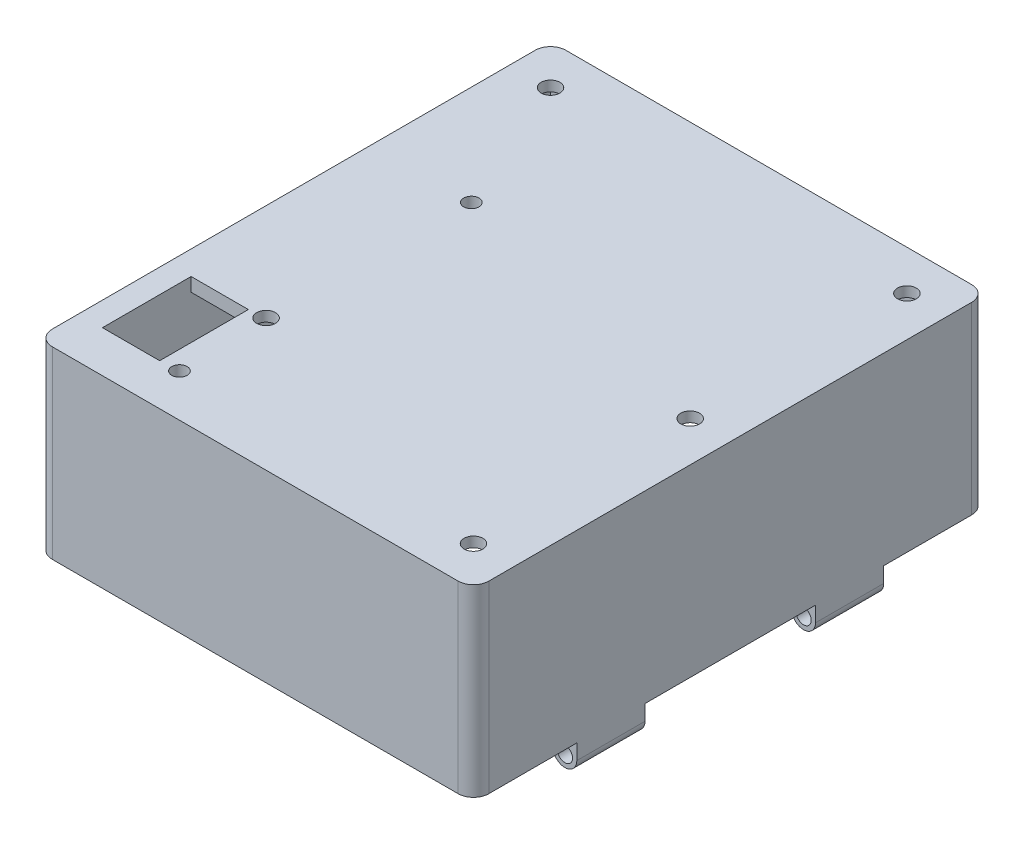
from build123d import *

# Parameters (mm, degrees)
EXTRUDE_BASE_DEPTH              = 2
SKETCH2_W                       = 57
SKETCH2_H                       = 68.2942
EXTRUDE_WALLS_DEPTH             = 25
SKETCH3_W                       = 8.390953786
SKETCH3_H                       = 13
CUT_USB_HOLE_DEPTH              = 75.121635616
SKETCH4_R                       = 1.375
CUT_CONNECTING_THRU_HOLES_DEPTH = 75.121635616
SKETCH5_R                       = 2.25
SKETCH5_R_2                     = 1.375
CUT_EXTRUDE3_DEPTH              = 0.5
SKETCH6_R                       = 1.125
CUT_CABLE_COVER_BOTTOM_DEPTH    = 75.121635616
SKETCH7_R                       = 1.125
CUT_CABLE_COVER_SIDE_DEPTH      = 2
SKETCH8_W                       = 3.5
SKETCH8_H                       = 10
EXTRUDE_HINGE_DEPTH             = 4
SKETCH9_R                       = 1.125
CUT_HINGE_HOLE_DEPTH            = 85.478484791
FILLET_HINGE_R                  = 1.75
SKETCH10_W                      = 40
SKETCH10_H                      = 5
CUT_NOTCH_DEPTH                 = 1.5
SKETCH11_W                      = 10
SKETCH11_H                      = 5
CUT_SIDE_NOTCH_DEPTH            = 1.5
FILLET_NOTCH_R                  = 1.5


with BuildPart() as part:
    # Sketch1 → Extrude Base (new body)
    with BuildSketch(Plane.XZ.offset(-16.914945084)):
        with BuildLine():
            Line((56.857940404, 38.199863775), (56.857940404, -32.594336225))
            ThreePointArc((56.857940404, -32.594336225), (56.198930662, -34.185326483), (54.607940404, -34.844336225))
            Line((54.607940404, -34.844336225), (-4.892059596, -34.844336225))
            ThreePointArc((-4.892059596, -34.844336225), (-6.483049854, -34.185326483), (-7.142059596, -32.594336225))
            Line((-7.142059596, -32.594336225), (-7.142059596, 38.199863775))
            ThreePointArc((-7.142059596, 38.199863775), (-6.483049854, 39.790854032), (-4.892059596, 40.449863775))
            Line((-4.892059596, 40.449863775), (54.607940404, 40.449863775))
            ThreePointArc((54.607940404, 40.449863775), (56.198930662, 39.790854032), (56.857940404, 38.199863775))
        make_face()
    extrude(amount=EXTRUDE_BASE_DEPTH)

    # Sketch2 → Extrude Walls (add)
    with BuildSketch(Plane.XZ.offset(-14.914945084)):
        with BuildLine():
            Line((56.857940404, -32.594336225), (56.857940404, 38.199863775))
            ThreePointArc((56.857940404, 38.199863775), (56.198930662, 39.790854032), (54.607940404, 40.449863775))
            Line((54.607940404, 40.449863775), (-4.892059596, 40.449863775))
            ThreePointArc((-4.892059596, 40.449863775), (-6.483049854, 39.790854032), (-7.142059596, 38.199863775))
            Line((-7.142059596, 38.199863775), (-7.142059596, -32.594336225))
            ThreePointArc((-7.142059596, -32.594336225), (-6.483049854, -34.185326483), (-4.892059596, -34.844336225))
            Line((-4.892059596, -34.844336225), (54.607940404, -34.844336225))
            ThreePointArc((54.607940404, -34.844336225), (56.198930662, -34.185326483), (56.857940404, -32.594336225))
        make_face()
        with Locations((24.857940404, 2.802763775)):
            Rectangle(SKETCH2_W, SKETCH2_H, mode=Mode.SUBTRACT)
    extrude(amount=EXTRUDE_WALLS_DEPTH)

    # Sketch3 → Cut USB Hole (cut, through all)
    with BuildSketch(Plane.XZ.offset(-14.914945084)):
        with Locations((0.553417297, 27.849863775)):
            Rectangle(SKETCH3_W, SKETCH3_H)
    extrude(amount=-CUT_USB_HOLE_DEPTH, mode=Mode.SUBTRACT)

    # Sketch4 → Cut Connecting Thru Holes (cut, through all)
    with BuildSketch(Plane.XZ.offset(-14.914945084)):
        with Locations((50.982940404, 34.574863775)):
            Circle(SKETCH4_R)
        with Locations((50.982940404, -28.969336225)):
            Circle(SKETCH4_R)
        with Locations((-1.267059596, -28.969336225)):
            Circle(SKETCH4_R)
        with Locations((50.982940404, 2.802763775)):
            Circle(SKETCH4_R)
        with Locations((7.12389419, 21.124863775)):
            Circle(SKETCH4_R)
    extrude(amount=-CUT_CONNECTING_THRU_HOLES_DEPTH, mode=Mode.SUBTRACT)

    # Sketch5 → Cut-Extrude3 (cut)
    # profile 1 of 5: a face of its own
    with BuildSketch(Plane.XZ.offset(-14.914945084)):
        with Locations((7.12389419, 21.124863775)):
            Circle(SKETCH5_R)
        with Locations((7.12389419, 21.124863775)):
            Circle(SKETCH5_R_2, mode=Mode.SUBTRACT)
    # profile 2 of 5: a face of its own
    with BuildSketch(Plane.XZ.offset(-14.914945084)):
        with Locations((50.982940404, 34.574863775)):
            Circle(SKETCH5_R)
    # profile 3 of 5: a face of its own
    with BuildSketch(Plane.XZ.offset(-14.914945084)):
        with Locations((50.982940404, 2.802763775)):
            Circle(SKETCH5_R)
    # profile 4 of 5: a face of its own
    with BuildSketch(Plane.XZ.offset(-14.914945084)):
        with Locations((50.982940404, -28.969336225)):
            Circle(SKETCH5_R)
    # profile 5 of 5: a face of its own
    with BuildSketch(Plane.XZ.offset(-14.914945084)):
        with Locations((-1.267059596, -28.969336225)):
            Circle(SKETCH5_R)
    extrude(amount=-CUT_EXTRUDE3_DEPTH, mode=Mode.SUBTRACT)

    # Sketch6 → Cut Cable Cover Bottom (cut, through all)
    with BuildSketch(Plane.XZ.offset(-14.914945084)):
        with Locations((7.49889419, 34.199863775)):
            Circle(SKETCH6_R)
        with Locations((7.49889419, -8.594336225)):
            Circle(SKETCH6_R)
    extrude(amount=-CUT_CABLE_COVER_BOTTOM_DEPTH, mode=Mode.SUBTRACT)

    # Sketch7 → Cut Cable Cover Side (cut)
    with BuildSketch(Plane(origin=(-3.642059596, 0, 0), x_dir=(0, 0, -1), z_dir=(1, 0, 0))):
        with Locations(Location((8.594336225, 7.164945084, 0), (0, 0, 90))):
            Circle(SKETCH7_R)
        with Locations(Location((-34.199863775, 7.164945084, 0), (0, 0, 90))):
            Circle(SKETCH7_R)
    extrude(amount=-CUT_CABLE_COVER_SIDE_DEPTH, mode=Mode.SUBTRACT)

    # Sketch8 → Extrude Hinge (add)
    with BuildSketch(Plane.XZ.offset(10.085054916)):
        with Locations((55.107940404, -14.697236225)):
            Rectangle(SKETCH8_W, SKETCH8_H)
        with Locations((55.107940404, 20.302763775)):
            Rectangle(SKETCH8_W, SKETCH8_H)
    extrude(amount=EXTRUDE_HINGE_DEPTH)

    # Sketch9 → Cut Hinge Hole (cut, through all)
    with BuildSketch(Plane(origin=(0, 0, -19.697236225), x_dir=(-1, 0, 0), z_dir=(0, 0, -1))):
        with Locations((-55.107940404, -12.335054916)):
            Circle(SKETCH9_R)
    extrude(amount=-CUT_HINGE_HOLE_DEPTH, mode=Mode.SUBTRACT)

    # Fillet Hinge
    fillet_hinge_edges = [part.edges().sort_by_distance(p)[0] for p in [
        (56.857940404, -14.085054916, 20.302763775),
        (53.357940404, -14.085054916, 20.302763775),
        (56.857940404, -14.085054916, -14.697236225),
        (53.357940404, -14.085054916, -14.697236225),
    ]]
    fillet(fillet_hinge_edges, radius=FILLET_HINGE_R - 0.0001)  # a hair under: the kernel refuses the full size

    # Sketch10 → Cut Notch (cut)
    with BuildSketch(Plane(origin=(-3.642059596, 0, 0), x_dir=(0, 0, -1), z_dir=(1, 0, 0))):
        with Locations((-2.802763775, -2.585054916)):
            Rectangle(SKETCH10_W, SKETCH10_H)
    extrude(amount=-CUT_NOTCH_DEPTH, mode=Mode.SUBTRACT)

    # Sketch11 → Cut Side Notch (cut)
    with BuildSketch(Plane.XY.offset(-31.344336225)):
        with Locations((11.357940404, -2.585054916)):
            Rectangle(SKETCH11_W, SKETCH11_H)
    cut_side_notch = extrude(amount=-CUT_SIDE_NOTCH_DEPTH, mode=Mode.SUBTRACT)

    # Mirror Side Notch: Cut Side Notch across plane
    add(cut_side_notch.mirror(Plane(origin=(0, 0, 2.802763775), x_dir=(1, 0, 0), z_dir=(0, 0, -1))), mode=Mode.SUBTRACT)

    # Fillet Notch
    fillet_notch_edges = [part.edges().sort_by_distance(p)[0] for p in [
        (-5.142059596, -5.085054916, 2.802763775),
        (-5.142059596, -0.085054916, 2.802763775),
        (11.357940404, -5.085054916, -32.844336225),
        (11.357940404, -0.085054916, -32.844336225),
        (11.357940404, -5.085054916, 38.449863775),
        (11.357940404, -0.085054916, 38.449863775),
    ]]
    fillet(fillet_notch_edges, radius=FILLET_NOTCH_R - 0.0001)  # a hair under: the kernel refuses the full size


solid = part.part
